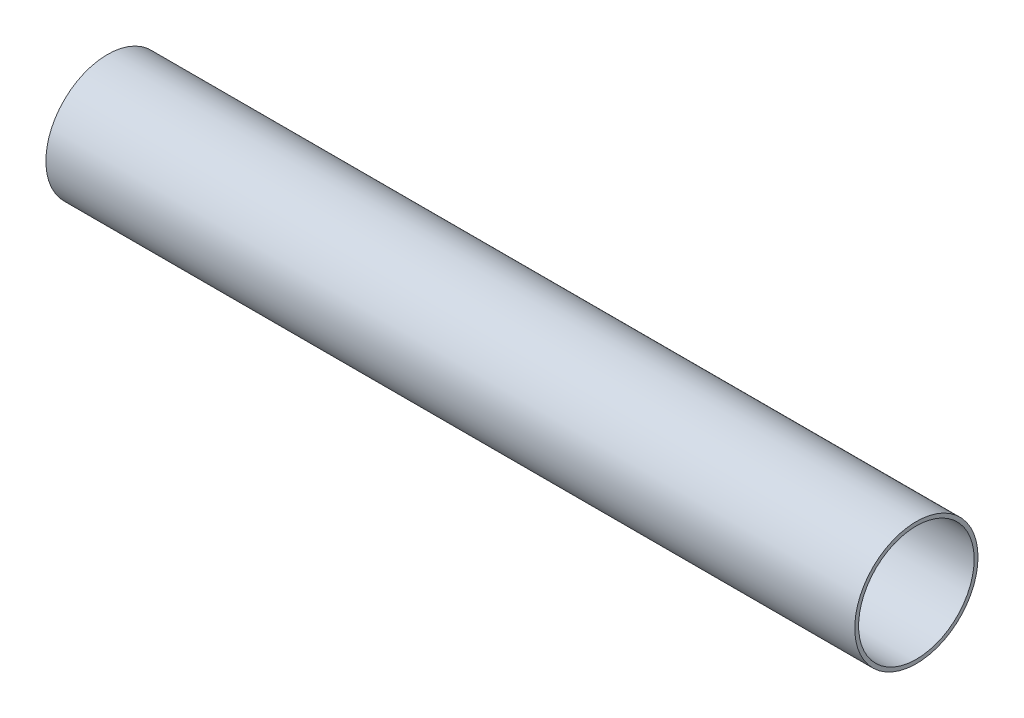
from build123d import *

# Parameters (mm, degrees)
SKETCH1_R           = 25.4
SKETCH1_R_2         = 23.8125
EXTRUDE_THIN1_DEPTH = 166.6875


with BuildPart() as part:
    # Sketch1 → Extrude-Thin1 (new, symmetric)
    with BuildSketch(Plane(origin=(0, 0, 0), x_dir=(0, 0, -1), z_dir=(1, 0, 0))):
        Circle(SKETCH1_R)
        Circle(SKETCH1_R_2, mode=Mode.SUBTRACT)
    extrude(amount=EXTRUDE_THIN1_DEPTH, both=True)


solid = part.part
